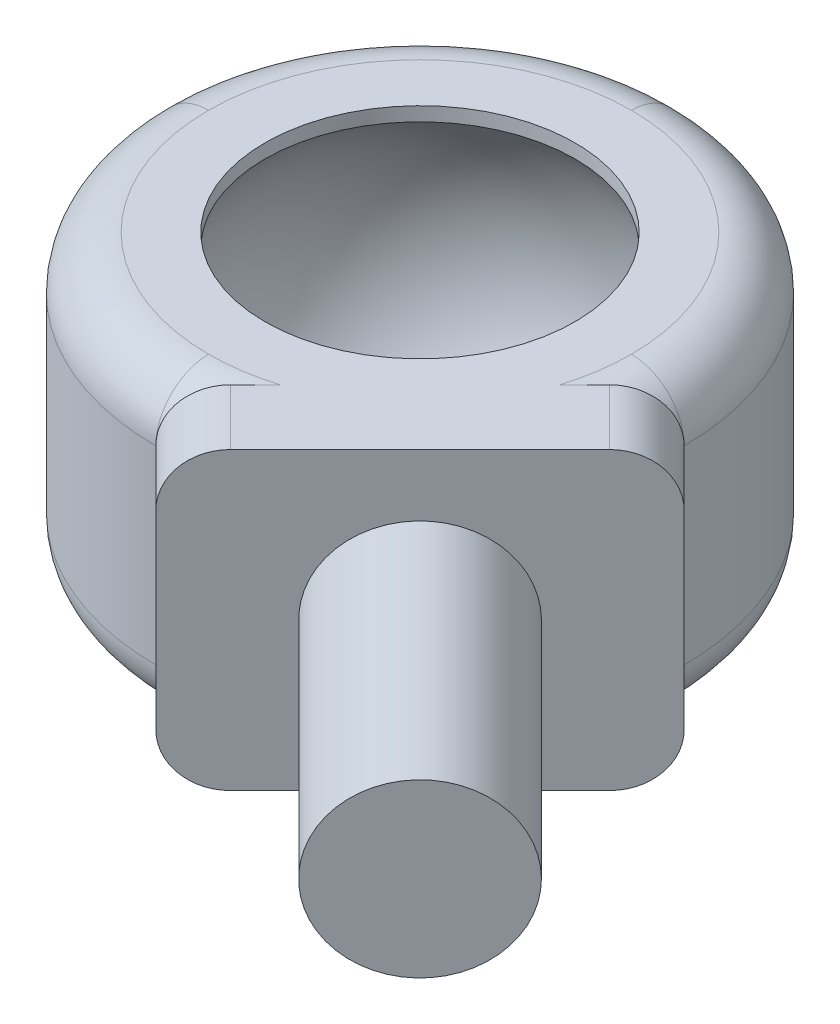
from build123d import *

# Parameters (mm, degrees)
SKETCH1_W           = 20
SKETCH1_H           = 20
BOSS_EXTRUDE1_DEPTH = 11.18
FILLET1_R           = 10
FILLET2_R           = 2
BOSS_EXTRUDE2_DEPTH = 15
SKETCH5_OUTSIDE_W   = 54.224
SKETCH5_OUTSIDE_H   = 22.12
SKETCH5_OUTSIDE_R   = 3.25
CUT_EXTRUDE1_DEPTH  = 12
CHAMFER1_SIZE       = 0.5
CHAMFER2_SIZE       = 0.353626002


# Some blends are built 0.0001 mm under size
with BuildPart() as part:
    # Sketch1 → Boss-Extrude1 (new body)
    with BuildSketch(Plane(origin=(0, 0, 0), x_dir=(1, 0, 0), z_dir=(0, 1, 0))):
        with Locations((-10, 10)):
            Rectangle(SKETCH1_W, SKETCH1_H)
    extrude(amount=BOSS_EXTRUDE1_DEPTH)

    # Sketch2 → Cut-Revolve1 (revolve, cut)
    with BuildSketch(Plane.XY.offset(-10)):
        with BuildLine():
            Line((-10, 13.34), (-10, -2.16))
            ThreePointArc((-10, -2.16), (-17.75, 5.59), (-10, 13.34))
        make_face()
    revolve(axis=Axis((-10, 13.34, -10), (0, -1, 0)), mode=Mode.SUBTRACT)

    # Fillet1
    fillet1_edges = [part.edges().sort_by_distance(p)[0] for p in [
        (-20, 5.59, 0),
        (-20, 5.59, -20),
        (0, 5.59, -20),
        (0, 5.59, 0),
    ]]
    fillet(fillet1_edges, radius=FILLET1_R - 0.0001)  # a hair under: the kernel refuses the full size

    # Fillet2
    fillet2_edges = [part.edges().sort_by_distance(p)[0] for p in [
        (-2.928902899, 0, -2.928902899),
        (-2.928902899, 0, -17.071097101),
        (-17.071097101, 0, -17.071097101),
        (-17.071097101, 0, -2.928902899),
        (-2.928902899, 11.18, -2.928902899),
        (-2.928902899, 11.18, -17.071097101),
        (-17.071097101, 11.18, -17.071097101),
        (-17.071097101, 11.18, -2.928902899),
    ]]
    fillet(fillet2_edges, radius=FILLET2_R)

    # Sketch4 → Boss-Extrude2 (add)
    with BuildSketch(Plane(origin=(-5, 0, -5), x_dir=(0.7071067811865474, 0, -0.7071067811865477), z_dir=(0.7071067811865477, 0, 0.7071067811865474))):
        with BuildLine():
            Line((-5.071067812, 11.18), (5.071067812, 11.18))
            ThreePointArc((5.071067812, 11.18), (6.485281374, 10.594213562), (7.071067812, 9.18))
            Line((7.071067812, 9.18), (7.071067812, 2))
            ThreePointArc((7.071067812, 2), (6.485281374, 0.585786438), (5.071067812, 0))
            Line((5.071067812, 0), (-5.071067812, 0))
            ThreePointArc((-5.071067812, 0), (-6.485281374, 0.585786438), (-7.071067812, 2))
            Line((-7.071067812, 2), (-7.071067812, 9.18))
            ThreePointArc((-7.071067812, 9.18), (-6.485281374, 10.594213562), (-5.071067812, 11.18))
        make_face()
    extrude(amount=BOSS_EXTRUDE2_DEPTH)

    # Sketch5 outside → Cut-Extrude1 (cut)
    with BuildSketch(Plane(origin=(5.606601718, 0, 5.606601718), x_dir=(0.7071067811865474, 0, -0.7071067811865477), z_dir=(0.7071067811865477, 0, 0.7071067811865474))):
        with Locations((0, 5.59)):
            Rectangle(SKETCH5_OUTSIDE_W, SKETCH5_OUTSIDE_H)
        with Locations((0, 5.59)):
            Circle(SKETCH5_OUTSIDE_R, mode=Mode.SUBTRACT)
    extrude(amount=-CUT_EXTRUDE1_DEPTH, mode=Mode.SUBTRACT)

    # Chamfer1
    # the kernel refuses this chamfer: 0.693202147, 0.5 mm, written as the material it takes off along each edge
    with BuildSketch(Plane(origin=(-10, 11.18, -10), x_dir=(-1, 0, 0), z_dir=(0, 0, -1))) as chamfer1_piece_1:
        with BuildLine():
            Line((5.867904619, -0.52737268), (5.367904619 + CHAMFER1_SIZE, 0))
            Line((5.367904619 + CHAMFER1_SIZE, 0), (5.367904619, 0))
            ThreePointArc((5.367904619, 0), (5.631023098, -0.265145178), (5.867904619, -0.52737268))
        make_face()
    revolve(axis=Axis((-10, 11.18, -10), (0, 1, 0)), mode=Mode.SUBTRACT)

    # Chamfer2
    # the kernel refuses this chamfer: 0.5, 0.353626002 mm, written as the material it takes off along each edge
    with BuildSketch(Plane(origin=(-10, 0, -10), x_dir=(-1, 0, 0), z_dir=(0, 0, -1))) as chamfer2_piece_1:
        with BuildLine():
            Line((5.367904619 + CHAMFER2_SIZE, 0), (5.729045055, 0.370752664))
            ThreePointArc((5.729045055, 0.370752664), (5.556671492, 0.187602206), (5.367904619, 0))
            Line((5.367904619, 0), (5.367904619 + CHAMFER2_SIZE, 0))
        make_face()
    revolve(axis=Axis((-10, 0, -10), (0, 1, 0)), mode=Mode.SUBTRACT)


solid = part.part
